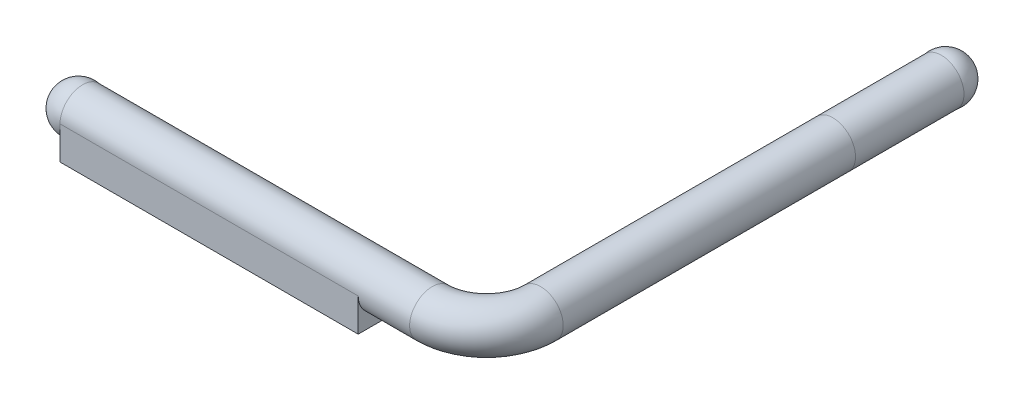
from build123d import *

# Parameters (mm, degrees)
SWEEP1_START        = -19.69
SWEEP1_OUTLINE_R    = 2.5
SWEEP1_DEPTH        = 38.69
SWEEP1_START_2      = -12
SWEEP1_2_OUTLINE_R  = 2.5
SWEEP1_2_DEPTH      = 44.35
SWEEP1_3_OUTLINE_R  = 2.5
SWEEP1_3_ANGLE      = 90
DOME1_FACE_RADIUS   = 2.5
DOME1_HEIGHT        = 3
DOME2_FACE_RADIUS   = 2.5
DOME2_HEIGHT        = 3
EXTRUDE1_REACH      = 51.69
EXTRUDE1_END_RADIUS = 2.5
SKETCH3_W           = 33
SKETCH3_H           = 5


with BuildPart() as part:
    # Sweep1: read off the stored shape, not the designer's step
    # Sweep1 outline → Sweep1 (new body)
    with BuildSketch(Plane.YZ.offset(SWEEP1_START)):
        with Locations((4, 38.35)):
            Circle(SWEEP1_OUTLINE_R)
    extrude(amount=SWEEP1_DEPTH)



with BuildPart() as body_2:
    # Sweep1 2 outline → Sweep1 2 (new body)
    with BuildSketch(Plane.XY.offset(SWEEP1_START_2)):
        with Locations((25, 4)):
            Circle(SWEEP1_2_OUTLINE_R)
    extrude(amount=SWEEP1_2_DEPTH)


with BuildPart() as part_1:
    add(part.part)

    add(body_2.part)  # Sweep1 3 merges body 2
    # Sweep1 3 outline → Sweep1 3 (revolve)
    with BuildSketch(Plane(origin=(19, 0, 32.35), x_dir=(0, 0, 1), z_dir=(-1, 0, 0))):
        with Locations((6, 4)):
            Circle(SWEEP1_3_OUTLINE_R)
    revolve(axis=Axis((19, 0, 32.35), (0, 1, 0)), revolution_arc=SWEEP1_3_ANGLE)

    # Dome1: a dome of height H over a round flat face of radius A is a cap of a sphere of radius (A * A + H * H) / (2 * H)
    dome1_r = (DOME1_FACE_RADIUS * DOME1_FACE_RADIUS + DOME1_HEIGHT * DOME1_HEIGHT) / (2 * DOME1_HEIGHT)
    dome1_base = Plane((-19.69, 4, 38.35), z_dir=(-1, 0, 0))
    with Locations(dome1_base.offset(DOME1_HEIGHT - dome1_r)):
        dome1_ball = Sphere(dome1_r, mode=Mode.PRIVATE)
    add(split(dome1_ball, bisect_by=dome1_base, keep=Keep.TOP, mode=Mode.PRIVATE))

    # Dome2: a dome of height H over a round flat face of radius A is a cap of a sphere of radius (A * A + H * H) / (2 * H)
    dome2_r = (DOME2_FACE_RADIUS * DOME2_FACE_RADIUS + DOME2_HEIGHT * DOME2_HEIGHT) / (2 * DOME2_HEIGHT)
    dome2_base = Plane((25, 4, -12), z_dir=(0, 0, -1))
    with Locations(dome2_base.offset(DOME2_HEIGHT - dome2_r)):
        dome2_ball = Sphere(dome2_r, mode=Mode.PRIVATE)
    add(split(dome2_ball, bisect_by=dome2_base, keep=Keep.TOP, mode=Mode.PRIVATE))

    # Extrude1: up to this cylinder (the profile starts outside it)
    extrude1_end = Plane(origin=(-3.19, 4, 38.35), z_dir=(-1, 0, 0)) * Cylinder(EXTRUDE1_END_RADIUS, 109.38, mode=Mode.PRIVATE)
    # Sketch3 → Extrude1 (add, up to the surface)
    with BuildSketch(Plane(origin=(0, 0.34, 0), x_dir=(-1, 0, 0), z_dir=(0, 1, 0)), mode=Mode.PRIVATE) as extrude1_sk1:
        with Locations((3.19, 38.35)):
            Rectangle(SKETCH3_W, SKETCH3_H)
    extrude1_tool1 = extrude(extrude1_sk1.sketch, amount=EXTRUDE1_REACH, mode=Mode.PRIVATE) - extrude1_end
    add(extrude1_tool1.solids().sort_by_distance((-3.19, 0.34, 38.35))[0])


solid = part_1.part
